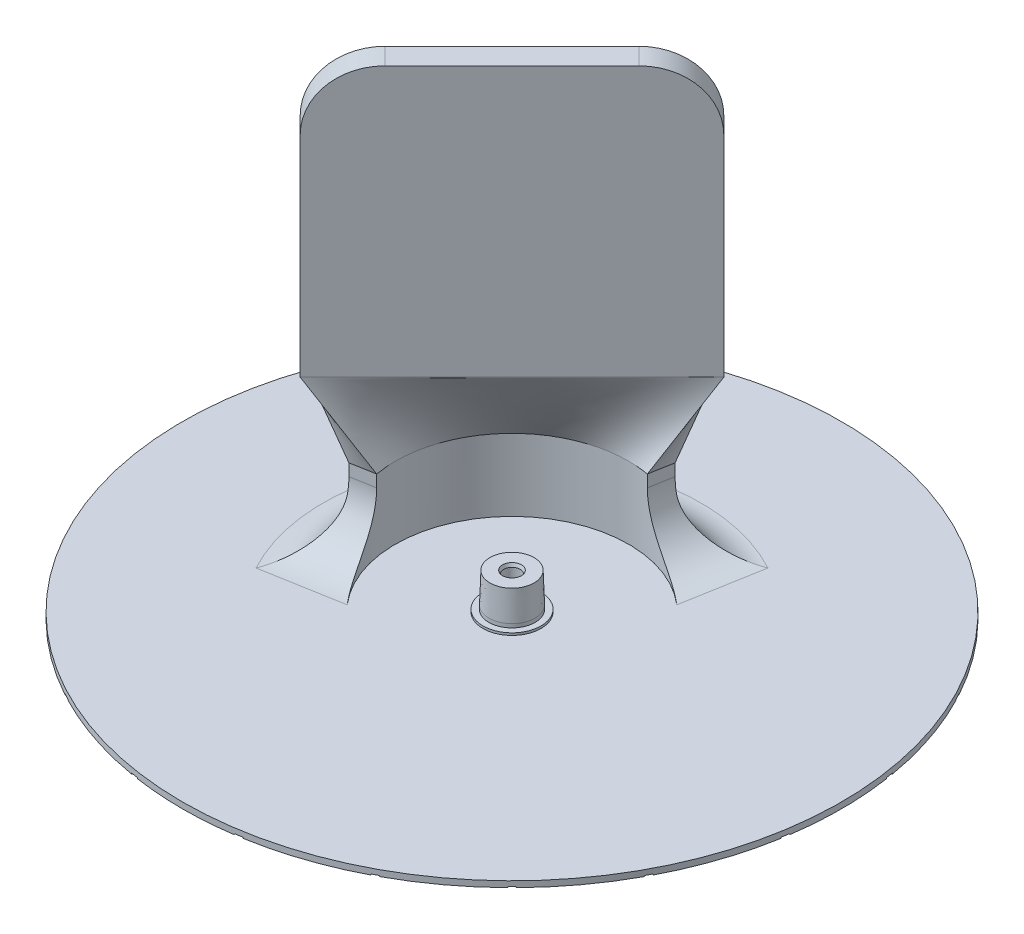
from build123d import *

# Parameters (mm, degrees)
SKETCH1_R           = 21.5
SKETCH1_R_2         = 2.15
BOSS_EXTRUDE1_DEPTH = 1
BOSS_EXTRUDE2_DEPTH = 12
SKETCH3_R           = 3.85
BOSS_EXTRUDE3_DEPTH = 6
CHAMFER1_SIZE       = 5
CHAMFER1_SIZE2      = 0.174603847
SKETCH4_R           = 1.375
CUT_EXTRUDE1_DEPTH  = 9
CHAMFER2_SIZE       = 0.2
CHAMFER2_SIZE2      = 0.549495484
SKETCH5_R           = 4.85
SKETCH5_R_2         = 3.85
BOSS_EXTRUDE4_DEPTH = 0.38
BOSS_EXTRUDE6_START = -1
SKETCH6_R           = 55
SKETCH6_R_2         = 2.15
BOSS_EXTRUDE6_DEPTH = 1
CUT_EXTRUDE2_DEPTH  = 0.16
CIRPATTERN1_COUNT   = 2
CIRPATTERN1_ANGLE   = 90
SKETCH9_R           = 2.15
SKETCH9_R_2         = 1.375
BOSS_EXTRUDE7_DEPTH = 1
BOSS_EXTRUDE8_DEPTH = 45
FILLET3_R           = 10
FILLET4_R           = 8


with BuildPart() as part:
    # Sketch1 → Boss-Extrude1 (new body)
    with BuildSketch(Plane(origin=(0, 0, 0), x_dir=(1, 0, 0), z_dir=(0, 1, 0))):
        with Locations(Location((0, 0, 0), (0, 0, 270))):
            Circle(SKETCH1_R)
        with Locations(Location((0, 0, 0), (0, 0, 270))):
            Circle(SKETCH1_R_2, mode=Mode.SUBTRACT)
    extrude(amount=BOSS_EXTRUDE1_DEPTH)

    # Sketch2 → Boss-Extrude2 (add)
    with BuildSketch(Plane(origin=(0, 1, 0), x_dir=(1, 0, 0), z_dir=(0, 1, 0))):
        with BuildLine():
            Line((3.386139465, 19.203751184), (4.080732175, 23.142982196))
            ThreePointArc((4.080732175, 23.142982196), (-16.617009358, 16.617009358), (-23.142982196, -4.080732175))
            Line((-23.142982196, -4.080732175), (-19.203751184, -3.386139465))
            ThreePointArc((-19.203751184, -3.386139465), (-13.788582233, 13.788582233), (3.386139465, 19.203751184))
        make_face()
    extrude(amount=BOSS_EXTRUDE2_DEPTH)

    # Sketch3 → Boss-Extrude3 (add)
    with BuildSketch(Plane(origin=(0, 1, 0), x_dir=(1, 0, 0), z_dir=(0, 1, 0))):
        with Locations(Location((0, 0, 0), (0, 0, 270))):
            Circle(SKETCH3_R)
    extrude(amount=BOSS_EXTRUDE3_DEPTH)

    # Chamfer1
    chamfer1_edges = [part.edges().sort_by_distance(p)[0] for p in [
        (0, 7, -3.85),
    ]]
    chamfer1_side = [part.faces().sort_by_distance(p)[0] for p in [
        (0, 4, -3.85),
    ]]
    chamfer(chamfer1_edges, length=CHAMFER1_SIZE, length2=CHAMFER1_SIZE2, reference=chamfer1_side[0])

    # Sketch4 → Cut-Extrude1 (cut)
    with BuildSketch(Plane(origin=(0, 7, 0), x_dir=(1, 0, 0), z_dir=(0, 1, 0))):
        with Locations(Location((0, 0, 0), (0, 0, 270))):
            Circle(SKETCH4_R)
    extrude(amount=-CUT_EXTRUDE1_DEPTH, mode=Mode.SUBTRACT)

    # Chamfer2
    chamfer2_edges = [part.edges().sort_by_distance(p)[0] for p in [
        (0, 7, -1.375),
    ]]
    chamfer2_side = [part.faces().sort_by_distance(p)[0] for p in [
        (0, 7, -3.571440251),
    ]]
    chamfer(chamfer2_edges, length=CHAMFER2_SIZE, length2=CHAMFER2_SIZE2, reference=chamfer2_side[0])

    # Sketch5 → Boss-Extrude4 (add)
    with BuildSketch(Plane(origin=(0, 1, 0), x_dir=(1, 0, 0), z_dir=(0, 1, 0))):
        with Locations(Location((0, 0, 0), (0, 0, 270))):
            Circle(SKETCH5_R)
        with Locations(Location((0, 0, 0), (0, 0, 270))):
            Circle(SKETCH5_R_2, mode=Mode.SUBTRACT)
    extrude(amount=BOSS_EXTRUDE4_DEPTH)

    # Sketch6 → Boss-Extrude6 (add)
    with BuildSketch(Plane(origin=(0, 1, 0), x_dir=(1, 0, 0), z_dir=(0, 1, 0)).offset(BOSS_EXTRUDE6_START)):
        with Locations(Location((0, 0, 0), (0, 0, 270))):
            Circle(SKETCH6_R)
        with Locations(Location((0, 0, 0), (0, 0, 270))):
            Circle(SKETCH6_R_2, mode=Mode.SUBTRACT)
    extrude(amount=BOSS_EXTRUDE6_DEPTH)

    # Sketch8 → Cut-Extrude2 (cut)
    with BuildSketch(Plane.XZ):
        Polygon((62.992339209, -63.69944599), (-63.69944599, 62.992339209), (-62.992339209, 63.69944599), (63.69944599, -62.992339209), align=None)
        Polygon((85.799872791, -63.69944599), (-40.891912408, 62.992339209), (-40.184805627, 63.69944599), (86.506979572, -62.992339209), align=None)
        Polygon((108.607406373, -63.69944599), (-18.084378826, 62.992339209), (-17.377272045, 63.69944599), (109.314513154, -62.992339209), align=None)
        Polygon((40.184805627, -63.69944599), (-86.506979572, 62.992339209), (-85.799872791, 63.69944599), (40.891912408, -62.992339209), align=None)
        Polygon((17.377272045, -63.69944599), (-109.314513154, 62.992339209), (-108.607406373, 63.69944599), (18.084378826, -62.992339209), align=None)
    cut_extrude2 = extrude(amount=-CUT_EXTRUDE2_DEPTH, mode=Mode.SUBTRACT)

    # CirPattern1: Cut-Extrude2 ×2 about axis
    cirpattern1_axis = Axis((0, 7, 0), (0, 1, 0))
    for i in range(1, CIRPATTERN1_COUNT):
        add(cut_extrude2.rotate(cirpattern1_axis, i * CIRPATTERN1_ANGLE / (CIRPATTERN1_COUNT - 1)), mode=Mode.SUBTRACT)

    # Sketch9 → Boss-Extrude7 (add)
    with BuildSketch(Plane.XZ.offset(-1)):
        Circle(SKETCH9_R)
        with Locations(Location((0, 0, 0), (0, 0, 90))):
            Circle(SKETCH9_R_2, mode=Mode.SUBTRACT)
    extrude(amount=BOSS_EXTRUDE7_DEPTH)

    # Loft1: read off the stored shape, not the designer's step
    # Loft1: loft between two sections, ruled curve by curve
    loft1_from = [
        Edge.make_bspline([(-19.203751184, 13, 3.386139465), (-19.434898106, 13, 2.075240128), (-19.54375143, 13, 0.6685729), (-19.423556991, 13, -2.26509238), (-19.193280563, 13, -3.791914095), (-18.329301138, 13, -6.840858944), (-17.694566895, 13, -8.361823108), (-16.022348775, 13, -11.238421731), (-14.984895831, 13, -12.592268636), (-12.592268636, 13, -14.984895831), (-11.238421731, 13, -16.022348775), (-8.361823108, 13, -17.694566895), (-6.840858944, 13, -18.329301138), (-3.791914095, 13, -19.193280563), (-2.26509238, 13, -19.423556991), (0.6685729, 13, -19.54375143), (2.075240128, 13, -19.434898106), (3.386139465, 13, -19.203751184)], [0, 0, 0, 0, 0.125, 0.125, 0.25, 0.25, 0.375, 0.375, 0.5, 0.5, 0.625, 0.625, 0.75, 0.75, 0.875, 0.875, 1, 1, 1, 1], 3),
        Edge.make_bspline([(3.386139465, 13, -19.203751184), (3.501904916, 13, -19.860289686), (3.617670368, 13, -20.516828188), (3.849201272, 13, -21.829905192), (3.964966723, 13, -22.486443694), (4.080732175, 13, -23.142982196)], [0, 0, 0, 0, 0.5, 0.5, 1, 1, 1, 1], 3),
        Edge.make_bspline([(-23.142982196, 13, 4.080732175), (-22.486443694, 13, 3.964966723), (-21.829905192, 13, 3.849201272), (-20.516828188, 13, 3.617670368), (-19.860289686, 13, 3.501904916), (-19.203751184, 13, 3.386139465)], [0, 0, 0, 0, 0.5, 0.5, 1, 1, 1, 1], 3),
        Edge.make_bspline([(4.080732175, 13, -23.142982196), (2.50093041, 13, -23.421543871), (0.805716059, 13, -23.552726082), (-2.729726715, 13, -23.407876374), (-4.569742628, 13, -23.130363756), (-8.244112061, 13, -22.089157781), (-10.077068873, 13, -21.324221642), (-13.543739009, 13, -19.308984421), (-15.175298099, 13, -18.058720616), (-18.058720616, 13, -15.175298099), (-19.308984421, 13, -13.543739009), (-21.324221642, 13, -10.077068873), (-22.089157781, 13, -8.244112061), (-23.130363756, 13, -4.569742628), (-23.407876374, 13, -2.729726715), (-23.552726082, 13, 0.805716059), (-23.421543871, 13, 2.50093041), (-23.142982196, 13, 4.080732175)], [0, 0, 0, 0, 0.125, 0.125, 0.25, 0.25, 0.375, 0.375, 0.5, 0.5, 0.625, 0.625, 0.75, 0.75, 0.875, 0.875, 1, 1, 1, 1], 3),
    ]
    loft1_to = [
        Edge.make_bspline([(-25.586475389, 27, 9.76886367), (-24.113336262, 27, 8.295724543), (-22.640197134, 27, 6.822585415), (-19.693918879, 27, 3.87630716), (-18.220779752, 27, 2.403168033), (-15.274501497, 27, -0.543110222), (-13.80136237, 27, -2.01624935), (-10.855084115, 27, -4.962527605), (-9.381944987, 27, -6.435666732), (-6.435666732, 27, -9.381944987), (-4.962527605, 27, -10.855084115), (-2.01624935, 27, -13.80136237), (-0.543110222, 27, -15.274501497), (2.403168033, 27, -18.220779752), (3.87630716, 27, -19.693918879), (6.822585415, 27, -22.640197134), (8.295724543, 27, -24.113336262), (9.76886367, 27, -25.586475389)], [0, 0, 0, 0, 0.125, 0.125, 0.25, 0.25, 0.375, 0.375, 0.5, 0.5, 0.625, 0.625, 0.75, 0.75, 0.875, 0.875, 1, 1, 1, 1], 3),
        Edge.make_bspline([(9.76886367, 27, -25.586475389), (9.297459149, 27, -26.05787991), (8.826054628, 27, -26.529284431), (7.883245587, 27, -27.472093472), (7.411841066, 27, -27.943497993), (6.940436545, 27, -28.414902514)], [0, 0, 0, 0, 0.5, 0.5, 1, 1, 1, 1], 3),
        Edge.make_bspline([(-28.414902514, 27, 6.940436545), (-27.943497993, 27, 7.411841066), (-27.472093472, 27, 7.883245587), (-26.529284431, 27, 8.826054628), (-26.05787991, 27, 9.297459149), (-25.586475389, 27, 9.76886367)], [0, 0, 0, 0, 0.5, 0.5, 1, 1, 1, 1], 3),
        Edge.make_bspline([(6.940436545, 27, -28.414902514), (5.467297418, 27, -26.941763387), (3.99415829, 27, -25.468624259), (1.047880035, 27, -22.522346004), (-0.425259092, 27, -21.049206877), (-3.371537347, 27, -18.102928622), (-4.844676474, 27, -16.629789494), (-7.790954729, 27, -13.683511239), (-9.264093857, 27, -12.210372112), (-12.210372112, 27, -9.264093857), (-13.683511239, 27, -7.790954729), (-16.629789494, 27, -4.844676474), (-18.102928622, 27, -3.371537347), (-21.049206877, 27, -0.425259092), (-22.522346004, 27, 1.047880035), (-25.468624259, 27, 3.99415829), (-26.941763387, 27, 5.467297418), (-28.414902514, 27, 6.940436545)], [0, 0, 0, 0, 0.125, 0.125, 0.25, 0.25, 0.375, 0.375, 0.5, 0.5, 0.625, 0.625, 0.75, 0.75, 0.875, 0.875, 1, 1, 1, 1], 3),
    ]
    loft1 = Solid(Shell([*[Face.make_surface_from_curves(loft1_from[k], loft1_to[k]) for k in range(4)], Face(Wire(loft1_from)), Face(Wire(loft1_to))]))
    add(loft1)

    # Sketch12 → Boss-Extrude8 (add)
    with BuildSketch(Plane(origin=(0, 27, 0), x_dir=(1, 0, 0), z_dir=(0, 1, 0))):
        Polygon((9.76886367, 25.586475389), (6.940436545, 28.414902514), (-28.414902514, -6.940436545), (-25.586475389, -9.76886367), align=None)
    extrude(amount=BOSS_EXTRUDE8_DEPTH)

    # Fillet3
    fillet3_edges = [part.edges().sort_by_distance(p)[0] for p in [
        (8.354650108, 72, -27.000688952),
        (-27.000688952, 72, 8.354650108),
        (3.73343582, 1, -21.17336669),
        (-21.17336669, 1, 3.73343582),
    ]]
    fillet(fillet3_edges, radius=FILLET3_R)

    # Fillet4
    fillet4_edges = [part.edges().sort_by_distance(p)[0] for p in [
        (-16.617009358, 1, -16.617009358),
    ]]
    fillet(fillet4_edges, radius=FILLET4_R)


solid = part.part
